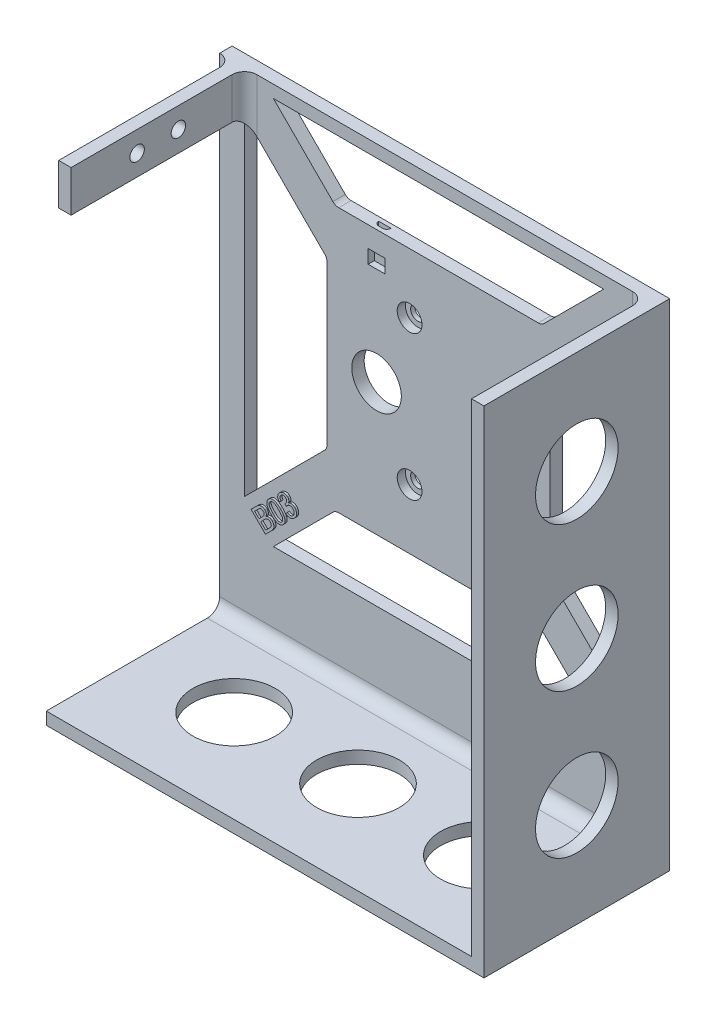
from build123d import *

# Parameters (mm, degrees)
SKETCH1_W              = 100
SKETCH1_H              = 100
SKETCH1_R              = 1.75
SKETCH1_R_2            = 6
SKETCH1_W_2            = 3
SKETCH1_H_2            = 20
BASE_DEPTH             = 3
REVISION_DEPTH         = 0.5
SKETCH3_R              = 3
STEPPER_HOLES_DEPTH    = 2
SKETCH5_W              = 3
SKETCH5_H              = 10
FRONT_TOWER_DEPTH      = 42
SKETCH8_R              = 1.75
FLIP_HOLDER_CUT_DEPTH  = 3
BOSS_EXTRUDE1_DEPTH    = 42
FILLET_2MM_R           = 2
FILLET_3MM_R           = 3
SKETCH11_R             = 10
BACK_CUT_DEPTH         = 3
SKETCH12_R             = 10
BOTTOM_CUT_DEPTH       = 3
SENSOR_W               = 4.1
SENSOR_H               = 3.3
SENSOR_CUT_DEPTH       = 1.5
SKETCH14_W             = 3
SKETCH14_H             = 1
SENSOR_WIRES_CUT_DEPTH = 5
FILLET1_R              = 1


with BuildPart() as part:
    # Sketch1 → Base (new body)
    # profile 1 of 5: a face of its own
    with BuildSketch(Plane.XY):
        Rectangle(SKETCH1_W, SKETCH1_H)
        Polygon((-25, -32), (25, -32), (40, -47), (-40, -47), align=None, mode=Mode.SUBTRACT)
        with Locations((-7, -17.5)):
            Circle(SKETCH1_R, mode=Mode.SUBTRACT)
        Polygon((-47, -40), (-47, 40), (-27, 20), (-27, -20), align=None, mode=Mode.SUBTRACT)
        with Locations((-15, 0)):
            Circle(SKETCH1_R_2, mode=Mode.SUBTRACT)
        with Locations((-7, 17.5)):
            Circle(SKETCH1_R, mode=Mode.SUBTRACT)
        Polygon((-25, 32), (-40, 47), (40, 47), (25, 32), align=None, mode=Mode.SUBTRACT)
        Polygon((27, 20), (47, 40), (47, -40), (27, -20), align=None, mode=Mode.SUBTRACT)
    # profile 2 of 5: a face of its own
    with BuildSketch(Plane.XY):
        with Locations((-51.5, 0)):
            Rectangle(SKETCH1_W_2, SKETCH1_H)
    # profile 3 of 5: a face of its own
    with BuildSketch(Plane.XY):
        with Locations((51.5, 0)):
            Rectangle(SKETCH1_W_2, SKETCH1_H)
    # profile 4 of 5: a face of its own
    with BuildSketch(Plane.XY):
        Polygon((50, -50), (-50, -50), (-53, -50), (-53, -70), (50, -70), align=None)
    # profile 5 of 5: a face of its own
    with BuildSketch(Plane.XY):
        with Locations((51.5, -60)):
            Rectangle(SKETCH1_W_2, SKETCH1_H_2)
    extrude(amount=BASE_DEPTH)

    # Sketch6 → Revision (add)
    # profile 1 of 3: a face of its own
    with BuildSketch(Plane.XY.offset(3)):
        with BuildLine():
            Line((-41.41119644, -44.875662534), (-44.898776568, -41.388082406))
            Line((-44.898776568, -41.388082406), (-43.589682017, -40.078987855))
            add(Edge.make_bspline(
                [(-43.589682017, -40.078987855), (-43.556888865, -40.046663386), (-43.493110432, -39.983796484), (-43.395453637, -39.896324353), (-43.299448926, -39.817249193), (-43.205227881, -39.746066447), (-43.113244145, -39.682238689), (-43.021838678, -39.628413564), (-42.932453763, -39.581727193), (-42.816436681, -39.531618076), (-42.670887465, -39.486145164), (-42.49332858, -39.45817011), (-42.314476325, -39.459472117), (-42.137777473, -39.488356993), (-41.967838426, -39.538449529), (-41.809892819, -39.610408635), (-41.665580233, -39.701241343), (-41.582743975, -39.777506479), (-41.541404773, -39.81556638)],
                knots=[0, 0, 0, 0, 0.948734756, 1.845166181, 2.700501511, 3.510942881, 4.278060177, 5.006048891, 5.695297297, 6.354750984, 7.608153375, 8.826358114, 10.044096525, 11.276957903, 12.504606231, 13.683779239, 14.844096564, 16, 16, 16, 16], degree=3))
            add(Edge.make_bspline(
                [(-41.541404773, -39.81556638), (-41.506098859, -39.853633504), (-41.435587552, -39.929659366), (-41.352159635, -40.061758029), (-41.284846645, -40.204137141), (-41.238259201, -40.357921103), (-41.210876569, -40.520632539), (-41.212619235, -40.69074579), (-41.23569545, -40.86704957), (-41.271532109, -40.982846906), (-41.29000253, -41.042529521)],
                knots=[0, 0, 0, 0, 0.94052932, 1.878380763, 2.821716592, 3.79155529, 4.785733926, 5.803706741, 6.868017763, 8, 8, 8, 8], degree=3))
            add(Edge.make_bspline(
                [(-41.29000253, -41.042529521), (-41.256166032, -41.025051861), (-41.189485881, -40.990609379), (-41.087441719, -40.947570106), (-40.985879065, -40.913565677), (-40.885307892, -40.886888925), (-40.784743676, -40.869850762), (-40.684525142, -40.861705512), (-40.584994273, -40.862916435), (-40.486544711, -40.872018708), (-40.389487462, -40.888509532), (-40.295253511, -40.915108098), (-40.203652835, -40.948501334), (-40.114106589, -40.987834625), (-40.028558837, -41.037937486), (-39.945646445, -41.095365448), (-39.863891646, -41.158743003), (-39.813872046, -41.20729974), (-39.788600286, -41.231832406)],
                knots=[0, 0, 0, 0, 1.118286565, 2.203759866, 3.248792234, 4.262008636, 5.256691218, 6.240437815, 7.211294842, 8.176340234, 9.142033091, 10.0984205, 11.047642346, 12.004482102, 12.966583526, 13.953940215, 14.966254609, 16, 16, 16, 16], degree=3))
            add(Edge.make_bspline(
                [(-39.788600286, -41.231832406), (-39.7499163, -41.273085763), (-39.673237119, -41.354857936), (-39.575819492, -41.490955825), (-39.49599643, -41.636311684), (-39.435078183, -41.788431681), (-39.390394706, -41.940794241), (-39.362035691, -42.089398937), (-39.353857683, -42.232508421), (-39.364019224, -42.371176319), (-39.392064584, -42.507872537), (-39.436750724, -42.645743402), (-39.498608254, -42.786366498), (-39.577218769, -42.93019982), (-39.674958821, -43.077195722), (-39.790698824, -43.229984458), (-39.927035739, -43.388043457), (-40.028389262, -43.491672594), (-40.081068235, -43.545534329)],
                knots=[0, 0, 0, 0, 1.022293041, 2.026383563, 3.018466127, 4.015610744, 4.984699821, 5.887461539, 6.746529383, 7.57021363, 8.39586659, 9.26500433, 10.187415547, 11.171300161, 12.226728177, 13.377999568, 14.637202865, 16, 16, 16, 16], degree=3))
            Line((-40.081068235, -43.545534329), (-41.41119644, -44.875662534))
        make_face()
        with BuildLine():
            Line((-42.971693235, -42.391688175), (-42.217486504, -41.637481444))
            add(Edge.make_bspline(
                [(-42.217486504, -41.637481444), (-42.192986026, -41.612899676), (-42.145475971, -41.565231986), (-42.079027545, -41.494446034), (-42.018535831, -41.428341398), (-41.965201153, -41.36637405), (-41.919545851, -41.307988264), (-41.878498711, -41.255137463), (-41.845834541, -41.205109643), (-41.826755814, -41.172800457), (-41.817847081, -41.157713816)],
                knots=[0, 0, 0, 0, 1.330213633, 2.579481183, 3.720929878, 4.764731027, 5.712056659, 6.561782955, 7.32843048, 8, 8, 8, 8], degree=3))
            add(Edge.make_bspline(
                [(-41.817847081, -41.157713816), (-41.799348863, -41.120462317), (-41.763629697, -41.048531473), (-41.730213615, -40.936296042), (-41.71609689, -40.826118139), (-41.72401489, -40.718372058), (-41.748449009, -40.612740835), (-41.795593839, -40.511713637), (-41.85871311, -40.413008788), (-41.913632339, -40.354599558), (-41.942045799, -40.324380483)],
                knots=[0, 0, 0, 0, 1.091773443, 2.108161731, 3.062918389, 3.995305036, 4.934114061, 5.8965854, 6.911760271, 8, 8, 8, 8], degree=3))
            add(Edge.make_bspline(
                [(-41.942045799, -40.324380483), (-41.971028869, -40.297115), (-42.027571474, -40.243923208), (-42.12346567, -40.180333535), (-42.224072276, -40.131506061), (-42.329499441, -40.09957624), (-42.436661268, -40.083480055), (-42.544021765, -40.088952393), (-42.649347828, -40.113540583), (-42.735710862, -40.149741602), (-42.805323432, -40.191412034), (-42.86427683, -40.230336424), (-42.928647899, -40.277976467), (-42.998666748, -40.333884756), (-43.073063148, -40.399227527), (-43.153870072, -40.471648561), (-43.23991468, -40.552585822), (-43.298038802, -40.610678367), (-43.328263748, -40.640886893)],
                knots=[0, 0, 0, 0, 1.162701337, 2.268295325, 3.352045144, 4.424505826, 5.480145542, 6.507184732, 7.54999636, 8.631497779, 9.231394588, 9.922394068, 10.698191652, 11.5740338, 12.543703873, 13.595266521, 14.749521923, 16, 16, 16, 16], degree=3))
            Line((-43.328263748, -40.640886893), (-44.025379132, -41.338002278))
            Line((-44.025379132, -41.338002278), (-42.971693235, -42.391688175))
        make_face(mode=Mode.SUBTRACT)
        with BuildLine():
            Line((-41.361116312, -44.002265098), (-40.492726889, -43.133875675))
            add(Edge.make_bspline(
                [(-40.492726889, -43.133875675), (-40.458503011, -43.099315893), (-40.395355767, -43.035548866), (-40.311409297, -42.946122909), (-40.246000133, -42.870982201), (-40.211371049, -42.82390152), (-40.19625253, -42.803346829)],
                knots=[0, 0, 0, 0, 1.313012639, 2.42266902, 3.311361874, 4, 4, 4, 4], degree=3))
            add(Edge.make_bspline(
                [(-40.19625253, -42.803346829), (-40.175737428, -42.772603357), (-40.136064349, -42.71315017), (-40.086237282, -42.621669087), (-40.049490005, -42.531423192), (-40.021967708, -42.442830775), (-40.007942456, -42.353169262), (-40.005650491, -42.261473717), (-40.017713453, -42.167045653), (-40.040124546, -42.070627097), (-40.076513436, -41.974377834), (-40.125498487, -41.880657958), (-40.189699696, -41.791707164), (-40.240369288, -41.73743864), (-40.266364709, -41.709596829)],
                knots=[0, 0, 0, 0, 1.101700938, 2.130521626, 3.099168453, 4.003044197, 4.890044265, 5.796109898, 6.728318699, 7.720664184, 8.741265392, 9.787657705, 10.86498453, 12, 12, 12, 12], degree=3))
            add(Edge.make_bspline(
                [(-40.266364709, -41.709596829), (-40.299249891, -41.679178185), (-40.363184086, -41.620039346), (-40.47153558, -41.550127002), (-40.585298196, -41.497843656), (-40.705112527, -41.467326778), (-40.826716676, -41.454824824), (-40.948772279, -41.462694764), (-41.069318903, -41.492838815), (-41.167944959, -41.533896561), (-41.247261444, -41.578037346), (-41.310774057, -41.617827665), (-41.377320581, -41.664256724), (-41.446464202, -41.717842798), (-41.519499177, -41.777711461), (-41.595192517, -41.844677829), (-41.673778122, -41.918401737), (-41.726475858, -41.970235284), (-41.753744517, -41.997056765)],
                knots=[0, 0, 0, 0, 1.240287802, 2.411323174, 3.559179878, 4.697738399, 5.823538817, 6.937050935, 8.071082966, 9.254062786, 9.888065121, 10.586837503, 11.331689515, 12.137250976, 13.012138357, 13.950197494, 14.939321289, 16, 16, 16, 16], degree=3))
            Line((-41.753744517, -41.997056765), (-42.560034581, -42.803346829))
            Line((-42.560034581, -42.803346829), (-41.361116312, -44.002265098))
        make_face(mode=Mode.SUBTRACT)
    # profile 2 of 3: a face of its own
    with BuildSketch(Plane.XY.offset(3)):
        with BuildLine():
            add(Edge.make_bspline(
                [(-40.021625078, -40.046587967), (-40.071701966, -39.995821638), (-40.169240225, -39.896940506), (-40.306320631, -39.747148898), (-40.433185004, -39.602309551), (-40.547479253, -39.459715388), (-40.650437588, -39.321087954), (-40.742235517, -39.186241628), (-40.822943347, -39.055302848), (-40.890926819, -38.926414107), (-40.949984309, -38.800721738), (-40.997762884, -38.676323044), (-41.037350125, -38.553702395), (-41.067253538, -38.432846629), (-41.088723803, -38.313443304), (-41.101048953, -38.195589443), (-41.102766113, -38.079010856), (-41.096080482, -37.964061123), (-41.079031895, -37.851083948), (-41.052031471, -37.739946147), (-41.013621603, -37.631804618), (-40.965312349, -37.52573187), (-40.90571344, -37.422517669), (-40.83619191, -37.321261717), (-40.757367581, -37.221359672), (-40.697276583, -37.159459444), (-40.66665713, -37.127918095)],
                knots=[0, 0, 0, 0, 1.519791035, 2.960203345, 4.32721718, 5.623086187, 6.854225503, 8.006911268, 9.099233322, 10.13067861, 11.111307965, 12.057534173, 12.969003293, 13.856145664, 14.709062442, 15.553116033, 16.378728747, 17.191514128, 18.0047044, 18.810732615, 19.625478281, 20.447063516, 21.291776829, 22.162236526, 23.063565014, 24, 24, 24, 24], degree=3))
            add(Edge.make_bspline(
                [(-40.66665713, -37.127918095), (-40.61989755, -37.083694682), (-40.528938359, -36.997668975), (-40.379125756, -36.89069766), (-40.22413781, -36.806445116), (-40.063139381, -36.74611762), (-39.898304351, -36.70653948), (-39.729215806, -36.68950048), (-39.557172088, -36.694589806), (-39.381993986, -36.722925271), (-39.203921306, -36.770681384), (-39.021178089, -36.836334645), (-38.835197562, -36.921963708), (-38.678637732, -37.008657774), (-38.549108984, -37.088418517), (-38.447682827, -37.160137373), (-38.340706129, -37.239403947), (-38.230458183, -37.328336756), (-38.115447573, -37.426061941), (-37.99674375, -37.533502967), (-37.872470062, -37.648966846), (-37.790143664, -37.730962899), (-37.747987258, -37.772950147)],
                knots=[0, 0, 0, 0, 1.142728202, 2.222894894, 3.260926844, 4.26929853, 5.269537204, 6.265560765, 7.28063128, 8.319561644, 9.411931067, 10.553056045, 11.766477685, 13.04648874, 13.731421814, 14.468830902, 15.253249663, 16.097441677, 16.985593074, 17.935146311, 18.942662222, 20, 20, 20, 20], degree=3))
            add(Edge.make_bspline(
                [(-37.747987258, -37.772950147), (-37.698244191, -37.823382612), (-37.601373193, -37.921596163), (-37.465290729, -38.070384083), (-37.339434901, -38.21422814), (-37.226109804, -38.355800435), (-37.123980351, -38.493869096), (-37.032319742, -38.628252529), (-36.952019878, -38.759073935), (-36.883325456, -38.887262485), (-36.825084243, -39.012794141), (-36.775891218, -39.136158247), (-36.734907627, -39.257938398), (-36.705327795, -39.379012127), (-36.683962338, -39.498435531), (-36.671870776, -39.616277384), (-36.668519328, -39.732835472), (-36.675593615, -39.848128217), (-36.692454813, -39.961478495), (-36.720040321, -40.072647388), (-36.756709089, -40.181909184), (-36.805139122, -40.288554401), (-36.865131175, -40.392404974), (-36.935101211, -40.494216076), (-37.015587481, -40.593926833), (-37.075448573, -40.656646661), (-37.105960014, -40.688615211)],
                knots=[0, 0, 0, 0, 1.511451577, 2.943441835, 4.301965756, 5.589298967, 6.811878956, 7.965880708, 9.059449834, 10.085786451, 11.067535361, 12.010814736, 12.918751839, 13.806907035, 14.667812675, 15.505742346, 16.332451144, 17.1532756, 17.967394267, 18.774342701, 19.594424777, 20.42343276, 21.269110458, 22.15046746, 23.057285793, 24, 24, 24, 24], degree=3))
            add(Edge.make_bspline(
                [(-37.105960014, -40.688615211), (-37.147823364, -40.728697738), (-37.229568191, -40.806965226), (-37.364390915, -40.90486727), (-37.501744071, -40.987099309), (-37.644483488, -41.051044045), (-37.792125181, -41.096593643), (-37.944657007, -41.121925033), (-38.101294075, -41.132160696), (-38.206414422, -41.123634738), (-38.259806168, -41.119304313)],
                knots=[0, 0, 0, 0, 1.088371856, 2.125218589, 3.124082956, 4.093326948, 5.058171928, 6.019806848, 6.994238768, 8, 8, 8, 8], degree=3))
            add(Edge.make_bspline(
                [(-38.259806168, -41.119304313), (-38.326324815, -41.109098), (-38.463612441, -41.08803322), (-38.668492487, -41.01938564), (-38.880046787, -40.926652017), (-39.097588462, -40.805328913), (-39.320831108, -40.65600018), (-39.550888223, -40.479596264), (-39.786956154, -40.275163842), (-39.941599864, -40.124535371), (-40.021625078, -40.046587967)],
                knots=[0, 0, 0, 0, 0.768501702, 1.586108254, 2.46161909, 3.40854508, 4.430599197, 5.531197834, 6.722441272, 8, 8, 8, 8], degree=3))
        make_face()
        with BuildLine():
            add(Edge.make_bspline(
                [(-39.581921553, -39.606884442), (-39.513001169, -39.674878706), (-39.380969748, -39.805135953), (-39.183451067, -39.983114066), (-38.998797012, -40.138656949), (-38.823970517, -40.267916282), (-38.662453302, -40.375420174), (-38.511486468, -40.457724488), (-38.37210677, -40.51649649), (-38.242288464, -40.55043576), (-38.121679017, -40.564943543), (-38.008569132, -40.568668708), (-37.901448201, -40.55939011), (-37.799902851, -40.539904794), (-37.704688614, -40.506608214), (-37.615639363, -40.461560541), (-37.530985997, -40.407166147), (-37.482204879, -40.360609522), (-37.457522514, -40.337052711)],
                knots=[0, 0, 0, 0, 1.856285709, 3.556103852, 5.097174173, 6.483912698, 7.723363391, 8.814765379, 9.776588567, 10.616668896, 11.378208224, 12.101912112, 12.782987398, 13.435886593, 14.079745841, 14.709639363, 15.347100805, 16, 16, 16, 16], degree=3))
            add(Edge.make_bspline(
                [(-37.457522514, -40.337052711), (-37.434142141, -40.311909056), (-37.388162106, -40.262461339), (-37.33130767, -40.178950958), (-37.287072615, -40.089214542), (-37.254880031, -39.993495541), (-37.235198836, -39.892147292), (-37.225585835, -39.784978008), (-37.231015055, -39.671918563), (-37.245024706, -39.551281005), (-37.279117891, -39.421468187), (-37.337840194, -39.28208675), (-37.42016044, -39.131120322), (-37.527659984, -38.969603687), (-37.656917216, -38.79477386), (-37.812172013, -38.610495399), (-37.989745592, -38.413247078), (-38.119687966, -38.281566267), (-38.187690783, -38.212653672)],
                knots=[0, 0, 0, 0, 0.657772097, 1.293580019, 1.929291208, 2.571163901, 3.224150318, 3.905316589, 4.629315384, 5.390956447, 6.231149002, 7.193100681, 8.28464847, 9.524264742, 10.911188522, 12.452464716, 14.143466308, 16, 16, 16, 16], degree=3))
            add(Edge.make_bspline(
                [(-38.187690783, -38.212653672), (-38.256944284, -38.144326842), (-38.389306081, -38.013736157), (-38.587469088, -37.835041282), (-38.772833569, -37.67936516), (-38.946997088, -37.548355375), (-39.109478941, -37.44224033), (-39.259876421, -37.360054091), (-39.398765385, -37.30080942), (-39.528336387, -37.267254103), (-39.64858818, -37.252199383), (-39.761711855, -37.250334862), (-39.868939004, -37.258725745), (-39.970830366, -37.279634773), (-40.066327292, -37.314525448), (-40.157053043, -37.359186678), (-40.241500675, -37.417167234), (-40.291617264, -37.463789466), (-40.317097835, -37.487493416)],
                knots=[0, 0, 0, 0, 1.859408653, 3.553822834, 5.098981892, 6.485122026, 7.717149665, 8.805081933, 9.757945757, 10.595355351, 11.354473639, 12.069354773, 12.754624008, 13.406729156, 14.050663812, 14.692825064, 15.335398436, 16, 16, 16, 16], degree=3))
            add(Edge.make_bspline(
                [(-40.317097835, -37.487493416), (-40.340425553, -37.512341729), (-40.385903975, -37.56078462), (-40.442643207, -37.641312488), (-40.488202945, -37.725557178), (-40.521318216, -37.814665119), (-40.543473596, -37.90750269), (-40.554528469, -38.004318974), (-40.553745358, -38.105308158), (-40.543628888, -38.173003844), (-40.538452001, -38.20764566)],
                knots=[0, 0, 0, 0, 1.04044371, 2.028391234, 3.00062065, 3.959482489, 4.924566025, 5.910404126, 6.930694132, 8, 8, 8, 8], degree=3))
            add(Edge.make_bspline(
                [(-40.538452001, -38.20764566), (-40.527717655, -38.254780775), (-40.505055456, -38.354291762), (-40.441620193, -38.504346381), (-40.356888385, -38.664364673), (-40.249266194, -38.835208975), (-40.11534364, -39.013921298), (-39.960325891, -39.204044632), (-39.781071579, -39.404138197), (-39.650261309, -39.537310617), (-39.581921553, -39.606884442)],
                knots=[0, 0, 0, 0, 0.674919572, 1.424880629, 2.268607608, 3.206465054, 4.244876459, 5.389724875, 6.636303052, 8, 8, 8, 8], degree=3))
        make_face(mode=Mode.SUBTRACT)
    # profile 3 of 3: a face of its own
    with BuildSketch(Plane.XY.offset(3)):
        with BuildLine():
            Line((-36.500701561, -38.124222142), (-36.12910701, -37.638444899))
            add(Edge.make_bspline(
                [(-36.12910701, -37.638444899), (-36.093677111, -37.661629331), (-36.024724685, -37.70675006), (-35.919667846, -37.764370818), (-35.818033688, -37.812971157), (-35.719692758, -37.852239259), (-35.62447067, -37.882818477), (-35.531921812, -37.903232193), (-35.442288358, -37.9131818), (-35.355658832, -37.914626197), (-35.271929716, -37.905901692), (-35.190586719, -37.891474953), (-35.112264101, -37.867964453), (-35.036304494, -37.837860091), (-34.963344512, -37.799611109), (-34.893023057, -37.754297636), (-34.825077948, -37.701912157), (-34.783265715, -37.661884726), (-34.76191951, -37.641449706)],
                knots=[0, 0, 0, 0, 1.352296331, 2.631791657, 3.824585107, 4.949639208, 6.012285314, 7.016527061, 7.971822393, 8.889206489, 9.778631857, 10.657311015, 11.524717488, 12.38633329, 13.264170397, 14.151803084, 15.056448584, 16, 16, 16, 16], degree=3))
            add(Edge.make_bspline(
                [(-34.76191951, -37.641449706), (-34.73764336, -37.616236761), (-34.689864644, -37.566614304), (-34.628842759, -37.484474761), (-34.576359711, -37.399568345), (-34.534259724, -37.310712915), (-34.500644926, -37.218596106), (-34.476708495, -37.12261337), (-34.46258285, -37.022909761), (-34.459133454, -36.920948767), (-34.463450354, -36.818940989), (-34.479001057, -36.719078953), (-34.502598655, -36.622553285), (-34.537098153, -36.529583272), (-34.581655959, -36.440326531), (-34.634637953, -36.353695684), (-34.698276605, -36.271227814), (-34.746449038, -36.220113953), (-34.770933933, -36.194134001)],
                knots=[0, 0, 0, 0, 1.039585775, 2.046044141, 3.035074835, 4.002910453, 4.963696771, 5.945880459, 6.938292124, 7.951482076, 8.975023308, 9.96887336, 10.951057047, 11.924576313, 12.910014511, 13.912697205, 14.939073936, 16, 16, 16, 16], degree=3))
            add(Edge.make_bspline(
                [(-34.770933933, -36.194134001), (-34.795561606, -36.170628983), (-34.843970087, -36.124427208), (-34.922207547, -36.06444874), (-35.00302897, -36.013790356), (-35.086803403, -35.972192111), (-35.173893846, -35.940366879), (-35.263457026, -35.917232538), (-35.355693684, -35.9027009), (-35.450053288, -35.899301686), (-35.544641992, -35.904009088), (-35.637236097, -35.918152289), (-35.727109111, -35.940934522), (-35.813720368, -35.974761713), (-35.898063232, -36.016723259), (-35.979409133, -36.068275456), (-36.058466906, -36.128693306), (-36.107167803, -36.175280575), (-36.132111817, -36.199142014)],
                knots=[0, 0, 0, 0, 1.070920322, 2.10501521, 3.096367477, 4.06916714, 5.043271319, 6.00923624, 6.976743188, 7.975917443, 8.975588895, 9.953483268, 10.919448188, 11.887411561, 12.874298254, 13.880136499, 14.914231386, 16, 16, 16, 16], degree=3))
            add(Edge.make_bspline(
                [(-36.132111817, -36.199142014), (-36.152848937, -36.221191115), (-36.197071082, -36.268211076), (-36.259274684, -36.349839323), (-36.323735662, -36.444501532), (-36.364858028, -36.513407373), (-36.386518869, -36.549702911)],
                knots=[0, 0, 0, 0, 0.836042805, 1.782870867, 2.832146972, 4, 4, 4, 4], degree=3))
            Line((-36.386518869, -36.549702911), (-36.71504451, -36.125023424))
            add(Edge.make_bspline(
                [(-36.71504451, -36.125023424), (-36.700450795, -36.113610044), (-36.674683526, -36.093458106), (-36.651136641, -36.070762456), (-36.64092592, -36.06092086)],
                knots=[0, 0, 0, 0, 1.132732781, 2, 2, 2, 2], degree=3))
            add(Edge.make_bspline(
                [(-36.64092592, -36.06092086), (-36.598107281, -36.014666853), (-36.513773563, -35.923566984), (-36.413015281, -35.76824864), (-36.337136947, -35.6022523), (-36.294729788, -35.456591199), (-36.276547739, -35.337591781), (-36.274223111, -35.249339419), (-36.284382124, -35.163020375), (-36.306596604, -35.079014424), (-36.341646166, -34.99735285), (-36.386486613, -34.916847858), (-36.444358327, -34.839328334), (-36.489518049, -34.791449929), (-36.512720792, -34.766850347)],
                knots=[0, 0, 0, 0, 1.549767001, 3.052353339, 4.534836071, 6.031022258, 6.770426535, 7.494033109, 8.197609912, 8.903488185, 9.625645721, 10.380203764, 11.167760271, 12, 12, 12, 12], degree=3))
            add(Edge.make_bspline(
                [(-36.512720792, -34.766850347), (-36.532453897, -34.748150614), (-36.571196447, -34.711436912), (-36.633550407, -34.662947446), (-36.698969585, -34.622488631), (-36.767446151, -34.590605475), (-36.837852269, -34.565417451), (-36.910549045, -34.546955237), (-36.985832621, -34.537079018), (-37.062685598, -34.535329954), (-37.139728798, -34.54048342), (-37.215950333, -34.55157626), (-37.289648415, -34.57388138), (-37.361962338, -34.601097504), (-37.431370868, -34.638376379), (-37.500193628, -34.681063148), (-37.565996335, -34.733552947), (-37.607425511, -34.772880734), (-37.628506048, -34.792892014)],
                knots=[0, 0, 0, 0, 1.042526244, 2.046820513, 3.024377355, 3.986967474, 4.939018436, 5.889603575, 6.858733046, 7.845310598, 8.833632614, 9.819128711, 10.792059532, 11.781542817, 12.778376816, 13.808874117, 14.885082586, 16, 16, 16, 16], degree=3))
            add(Edge.make_bspline(
                [(-37.628506048, -34.792892014), (-37.648643657, -34.813536632), (-37.688241173, -34.854131103), (-37.7390961, -34.920620779), (-37.7827715, -34.989301525), (-37.818656158, -35.06054401), (-37.848227832, -35.133741921), (-37.868969062, -35.209441509), (-37.883490238, -35.287135936), (-37.889167236, -35.367047133), (-37.887441806, -35.448965666), (-37.876005664, -35.531762856), (-37.856897154, -35.616003499), (-37.828382737, -35.700889201), (-37.792385929, -35.787511318), (-37.746567679, -35.874906951), (-37.692976417, -35.963760949), (-37.6516148, -36.021461856), (-37.630509253, -36.050904834)],
                knots=[0, 0, 0, 0, 0.995080987, 1.956673988, 2.884214945, 3.801960196, 4.707531962, 5.605439247, 6.507702643, 7.432588864, 8.366698081, 9.331946949, 10.313580278, 11.345318308, 12.420149226, 13.549373354, 14.749521418, 16, 16, 16, 16], degree=3))
            Line((-37.630509253, -36.050904834), (-38.135316945, -36.403468937))
            add(Edge.make_bspline(
                [(-38.135316945, -36.403468937), (-38.163399931, -36.361500575), (-38.218332705, -36.27940679), (-38.287208818, -36.151359981), (-38.34512159, -36.023720526), (-38.389915852, -35.89558614), (-38.423956562, -35.767479965), (-38.443716234, -35.638543195), (-38.451836744, -35.509470062), (-38.447808445, -35.380695751), (-38.431871661, -35.253568522), (-38.403767844, -35.128752044), (-38.36326429, -35.007225348), (-38.312129425, -34.888867727), (-38.249744122, -34.773448905), (-38.173809172, -34.662670082), (-38.087802263, -34.553841256), (-38.023032806, -34.485904817), (-37.990084574, -34.45134554)],
                knots=[0, 0, 0, 0, 1.127874184, 2.206220518, 3.244809048, 4.25709718, 5.236092009, 6.202669732, 7.166969997, 8.122426609, 9.077446175, 10.025885875, 10.976699572, 11.935790494, 12.903979373, 13.903456542, 14.933488014, 16, 16, 16, 16], degree=3))
            add(Edge.make_bspline(
                [(-37.990084574, -34.45134554), (-37.942050517, -34.406036068), (-37.847269, -34.316630742), (-37.688227347, -34.205232896), (-37.520166662, -34.11445317), (-37.344266429, -34.045288566), (-37.164917161, -33.999630733), (-36.986487092, -33.975748629), (-36.810680573, -33.98186369), (-36.639668128, -34.010294145), (-36.477176418, -34.062984639), (-36.324545666, -34.133135432), (-36.18517974, -34.22459362), (-36.103772196, -34.299598505), (-36.06300124, -34.337162847)],
                knots=[0, 0, 0, 0, 1.104229229, 2.178881593, 3.239180132, 4.29575997, 5.334133248, 6.331019452, 7.298340607, 8.267726346, 9.223988327, 10.149151963, 11.073048541, 12, 12, 12, 12], degree=3))
            add(Edge.make_bspline(
                [(-36.06300124, -34.337162847), (-36.027859814, -34.375667077), (-35.958536192, -34.451624515), (-35.873888045, -34.580722016), (-35.812162318, -34.721123656), (-35.769497567, -34.870003681), (-35.749572651, -35.026651457), (-35.752580006, -35.188984269), (-35.781224147, -35.356638769), (-35.817767148, -35.466384343), (-35.836639061, -35.523060283)],
                knots=[0, 0, 0, 0, 0.977023314, 1.927377554, 2.88076159, 3.844440831, 4.823409989, 5.832088996, 6.880425058, 8, 8, 8, 8], degree=3))
            add(Edge.make_bspline(
                [(-35.836639061, -35.523060283), (-35.805265271, -35.504054052), (-35.743589159, -35.466690683), (-35.646624959, -35.422531606), (-35.550787724, -35.384373786), (-35.453558145, -35.357821579), (-35.356296466, -35.337910175), (-35.257897617, -35.329355603), (-35.159358969, -35.32923764), (-35.060766998, -35.338290586), (-34.963046465, -35.35659881), (-34.865816417, -35.382253948), (-34.771128809, -35.419092803), (-34.677207874, -35.462476575), (-34.587095722, -35.517878764), (-34.497539739, -35.580051038), (-34.409195087, -35.650689641), (-34.354171712, -35.704208515), (-34.326222394, -35.731393616)],
                knots=[0, 0, 0, 0, 1.058771056, 2.081383353, 3.073708434, 4.035566366, 4.988923935, 5.93812529, 6.883349012, 7.832550367, 8.793585846, 9.752877334, 10.732749511, 11.725074591, 12.737400846, 13.783576244, 14.874159695, 16, 16, 16, 16], degree=3))
            add(Edge.make_bspline(
                [(-34.326222394, -35.731393616), (-34.289663599, -35.76973318), (-34.217687289, -35.845215436), (-34.125452063, -35.969478677), (-34.047579061, -36.099181658), (-33.98513227, -36.235677667), (-33.936974258, -36.377953574), (-33.9036458, -36.526660336), (-33.885822977, -36.681083673), (-33.883412012, -36.839666479), (-33.893645196, -36.999044469), (-33.920607518, -37.15592719), (-33.964648297, -37.307816646), (-34.02128978, -37.455960799), (-34.095313019, -37.599066567), (-34.185225185, -37.73733573), (-34.289115287, -37.87234739), (-34.368822561, -37.955656012), (-34.409355407, -37.998020219)],
                knots=[0, 0, 0, 0, 1.003504436, 1.975681832, 2.926548701, 3.866802859, 4.81551868, 5.769078036, 6.7504218, 7.75695557, 8.772029936, 9.774076238, 10.767792501, 11.765692512, 12.776257875, 13.815589513, 14.889180759, 16, 16, 16, 16], degree=3))
            add(Edge.make_bspline(
                [(-34.409355407, -37.998020219), (-34.447441762, -38.034802448), (-34.5221584, -38.106960693), (-34.643414593, -38.201141848), (-34.767874926, -38.282835236), (-34.896139788, -38.351275747), (-35.028398441, -38.405746314), (-35.164239919, -38.446934357), (-35.30371935, -38.475330403), (-35.44567672, -38.488756665), (-35.587888346, -38.490394743), (-35.727945459, -38.476701604), (-35.865381864, -38.452265208), (-35.999050264, -38.412523533), (-36.129850126, -38.360278513), (-36.257400956, -38.294613353), (-36.382356811, -38.216531079), (-36.460822401, -38.155327898), (-36.500701561, -38.124222142)],
                knots=[0, 0, 0, 0, 1.097168565, 2.152391502, 3.177694333, 4.181052276, 5.161925655, 6.138612951, 7.12017007, 8.107932323, 9.090952998, 10.06427354, 11.021509135, 11.980969902, 12.950220072, 13.937836769, 14.9519312, 16, 16, 16, 16], degree=3))
        make_face()
    extrude(amount=REVISION_DEPTH)

    # Sketch3 → Stepper_Holes (cut)
    with BuildSketch(Plane.XY.offset(3)):
        with Locations((-7, 17.5)):
            Circle(SKETCH3_R)
        with Locations((-7, -17.5)):
            Circle(SKETCH3_R)
    extrude(amount=-STEPPER_HOLES_DEPTH, mode=Mode.SUBTRACT)

    # Sketch5 → Front_Tower (add)
    with BuildSketch(Plane.XY.offset(3)):
        with Locations((-48.5, 45)):
            Rectangle(SKETCH5_W, SKETCH5_H)
    extrude(amount=FRONT_TOWER_DEPTH)

    # Sketch8 → Flip_Holder_Cut (cut)
    with BuildSketch(Plane(origin=(-47, 0, 0), x_dir=(0, 0, -1), z_dir=(1, 0, 0))):
        with Locations((-29, 45)):
            Circle(SKETCH8_R)
        with Locations(Location((-19, 45, 0), (0, 0, 90))):
            Circle(SKETCH8_R)
    extrude(amount=-FLIP_HOLDER_CUT_DEPTH, mode=Mode.SUBTRACT)

    # Sketch10 → Boss-Extrude1 (add)
    with BuildSketch(Plane.XY.offset(3)):
        Polygon((-53, -70), (53, -70), (53, 50), (50, 50), (50, -67), (-53, -67), align=None)
    extrude(amount=BOSS_EXTRUDE1_DEPTH)

    # Fillet-2mm
    fillet_2mm_edges = [part.edges().sort_by_distance(p)[0] for p in [
        (25, -32, 1.5),
        (-25, -32, 1.5),
        (-27, -20, 1.5),
        (-27, 20, 1.5),
        (27, 20, 1.5),
        (27, -20, 1.5),
        (25, 32, 1.5),
        (-25, 32, 1.5),
    ]]
    fillet(fillet_2mm_edges, radius=FILLET_2MM_R)

    # Fillet-3mm
    # the kernel refuses this fillet: 3 mm, written as the material it adds along each edge
    with BuildSketch(Plane(origin=(-50, 50, 3), x_dir=(-1, 0, 0), z_dir=(0, -1, 0))) as fillet_3mm_piece_1:
        with BuildLine():
            CenterArc((FILLET_3MM_R, -FILLET_3MM_R), FILLET_3MM_R, 90, 90)
            Line((0, -FILLET_3MM_R), (0, 0))
            Line((0, 0), (FILLET_3MM_R, 0))
        make_face()
    extrude(amount=10)
    with BuildSketch(Plane(origin=(-47, 32.5, 3), x_dir=(1, 0, 0), z_dir=(0, 1, 0))) as fillet_3mm_piece_2_section:
        with BuildLine():
            CenterArc((FILLET_3MM_R, -FILLET_3MM_R), FILLET_3MM_R, 90, 90)
            Line((0, -FILLET_3MM_R), (0, 0))
            Line((0, 0), (FILLET_3MM_R, 0))
        make_face()
    fillet_3mm_piece_2 = extrude(amount=17.5, mode=Mode.PRIVATE)
    fillet_3mm_piece_2 = split(fillet_3mm_piece_2, bisect_by=Plane(origin=(-46.14326651, 39.14326651, 3.39231132), z_dir=(0.7071067811865464, 0.7071067811865487, 0)), keep=Keep.TOP, mode=Mode.PRIVATE)
    add(fillet_3mm_piece_2)
    with BuildSketch(Plane(origin=(50, 50, 3), x_dir=(-1, 0, 0), z_dir=(0, -1, 0))) as fillet_3mm_piece_3:
        with BuildLine():
            CenterArc((FILLET_3MM_R, -FILLET_3MM_R), FILLET_3MM_R, 90, 90)
            Line((0, -FILLET_3MM_R), (0, 0))
            Line((0, 0), (FILLET_3MM_R, 0))
        make_face()
    extrude(amount=117)
    with BuildSketch(Plane(origin=(50, -67, 3), x_dir=(0, 1, 0), z_dir=(-1, 0, 0))) as fillet_3mm_piece_4:
        with BuildLine():
            CenterArc((FILLET_3MM_R, -FILLET_3MM_R), FILLET_3MM_R, 90, 90)
            Line((0, -FILLET_3MM_R), (0, 0))
            Line((0, 0), (FILLET_3MM_R, 0))
        make_face()
    extrude(amount=103)

    # Sketch11 → Back_Cut (cut)
    with BuildSketch(Plane(origin=(53, 0, 0), x_dir=(0, 0, -1), z_dir=(1, 0, 0))):
        with Locations((-22.5, -10)):
            Circle(SKETCH11_R)
        with Locations((-22.5, -45)):
            Circle(SKETCH11_R)
        with Locations((-22.5, 25)):
            Circle(SKETCH11_R)
    extrude(amount=-BACK_CUT_DEPTH, mode=Mode.SUBTRACT)

    # Sketch12 → Bottom_Cut (cut)
    with BuildSketch(Plane.XZ.offset(70)):
        with Locations(Location((0, 22.5, 0), (0, 0, 270))):
            Circle(SKETCH12_R)
        with Locations(Location((-30, 22.5, 0), (0, 0, 270))):
            Circle(SKETCH12_R)
        with Locations(Location((30, 22.5, 0), (0, 0, 270))):
            Circle(SKETCH12_R)
    extrude(amount=-BOTTOM_CUT_DEPTH, mode=Mode.SUBTRACT)

    # Sensor → Sensor_Cut (cut)
    with BuildSketch(Plane.XY.offset(3)):
        with Locations((-15, 25.35)):
            Rectangle(SENSOR_W, SENSOR_H)
    extrude(amount=-SENSOR_CUT_DEPTH, mode=Mode.SUBTRACT)

    # Sketch14 → Sensor_Wires_Cut (cut)
    with BuildSketch(Plane(origin=(0, 32, 0), x_dir=(1, 0, 0), z_dir=(0, 1, 0))):
        with Locations((-15.001572875, -1.5)):
            Rectangle(SKETCH14_W, SKETCH14_H)
    extrude(amount=-SENSOR_WIRES_CUT_DEPTH, mode=Mode.SUBTRACT)

    # Fillet1
    # the kernel refuses this fillet: 1 mm, written as the material it adds along each edge
    with BuildSketch(Plane(origin=(-13.501572875, 32, 2), x_dir=(-1, 0, 0), z_dir=(0, -1, 0)), Plane(origin=(-16.501572875, 32, 2), x_dir=(0, 0, -1), z_dir=(0, -1, 0))) as fillet1_piece_1:
        with BuildLine():
            CenterArc((FILLET1_R, FILLET1_R), FILLET1_R, 180, 90)
            Line((0, FILLET1_R), (0, 0))
            Line((0, 0), (FILLET1_R, 0))
        make_face()
    extrude(amount=5)


solid = part.part
